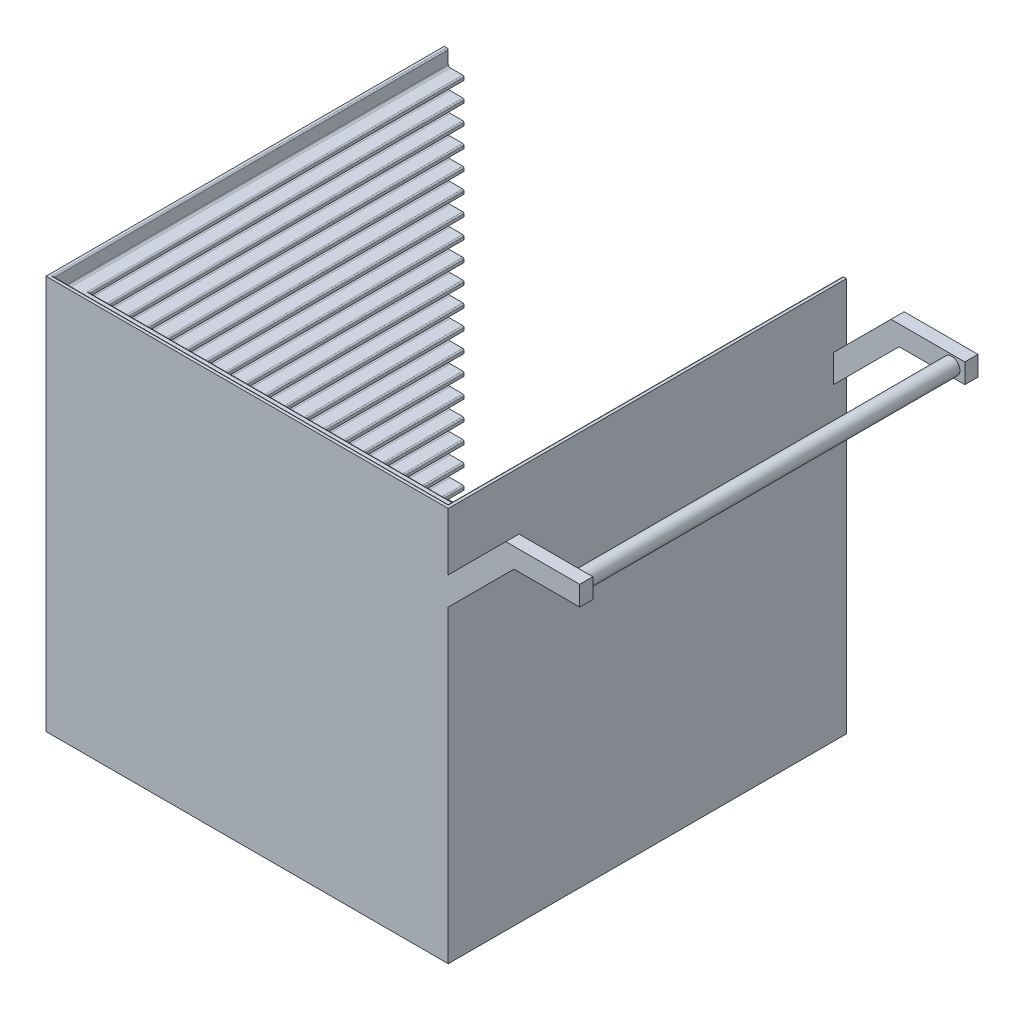
from build123d import *

# Parameters (mm, degrees)
BOSS_EXTRUDE1_DEPTH   = 600
BOSS_EXTRUDE1_2_DEPTH = 600
LPATTERN1_COUNT       = 20
LPATTERN1_PITCH       = 30
SKETCH3_W             = 6
SKETCH3_H             = 30
BOSS_EXTRUDE3_DEPTH   = 612
BOSS_EXTRUDE5_START   = 30
BOSS_EXTRUDE5_DEPTH   = 30
LPATTERN3_COUNT       = 20
LPATTERN3_PITCH       = 30
LPATTERN4_COUNT       = 20
LPATTERN4_PITCH       = 30
FILLET1_R             = 2
SKETCH11_W            = 552
SKETCH11_H            = 570
BOSS_EXTRUDE6_DEPTH   = 6
SKETCH16_W            = 100
SKETCH16_H            = 130
BOSS_EXTRUDE7_DEPTH   = 20
BOSS_EXTRUDE8_DEPTH   = 20
BOSS_EXTRUDE9_DEPTH   = 20
SKETCH19_R            = 12.5
BOSS_EXTRUDE10_DEPTH  = 606


with BuildPart() as part:
    # Sketch1 → Boss-Extrude1 (new body)
    with BuildSketch(Plane.XY):
        with BuildLine():
            Line((-300, 28), (-300, 9))
            ThreePointArc((-300, 9), (-299.121320344, 6.878679656), (-297, 6))
            Line((-297, 6), (-278, 6))
            ThreePointArc((-278, 6), (-276.585786438, 5.414213562), (-276, 4))
            Line((-276, 4), (-276, 0))
            Line((-276, 0), (-306, 0))
            Line((-306, 0), (-306, 30))
            Line((-306, 30), (-302, 30))
            ThreePointArc((-302, 30), (-300.585786438, 29.414213562), (-300, 28))
        make_face()
    boss_extrude1 = extrude(amount=BOSS_EXTRUDE1_DEPTH)


with BuildPart() as body_2:
    # Sketch1 → Boss-Extrude1 2 (new body)
    with BuildSketch(Plane.XY):
        with BuildLine():
            Line((306, 30), (302, 30))
            ThreePointArc((302, 30), (300.585786438, 29.414213562), (300, 28))
            Line((300, 28), (300, 9))
            ThreePointArc((300, 9), (299.121320344, 6.878679656), (297, 6))
            Line((297, 6), (278, 6))
            ThreePointArc((278, 6), (276.585786438, 5.414213562), (276, 4))
            Line((276, 4), (276, 0))
            Line((276, 0), (306, 0))
            Line((306, 0), (306, 30))
        make_face()
    boss_extrude1_2 = extrude(amount=BOSS_EXTRUDE1_2_DEPTH)


with BuildPart() as part_1:
    add(part.part)

    add(body_2.part)  # LPattern1 merges body 2
    # LPattern1: Boss-Extrude1, Boss-Extrude1 2 ×20
    with Locations(*[(0, -i * LPATTERN1_PITCH, 0) for i in range(1, LPATTERN1_COUNT)]):
        add(boss_extrude1)
        add(boss_extrude1_2)

    # Sketch3 → Boss-Extrude3 (add)
    with BuildSketch(Plane.ZY.offset(306)):
        with Locations((603, 15)):
            Rectangle(SKETCH3_W, SKETCH3_H)
    boss_extrude3 = extrude(amount=-BOSS_EXTRUDE3_DEPTH)

    # Sketch5 → Boss-Extrude5 (add)
    with BuildSketch(Plane(origin=(0, 0, 600), x_dir=(-1, 0, 0), z_dir=(0, 0, -1)).offset(BOSS_EXTRUDE5_START)):
        with BuildLine():
            Line((276, 0), (276, 4))
            ThreePointArc((276, 4), (276.585786438, 5.414213562), (278, 6))
            Line((278, 6), (-278, 6))
            ThreePointArc((-278, 6), (-276.585786438, 5.414213562), (-276, 4))
            Line((-276, 4), (-276, 0))
            Line((-276, 0), (276, 0))
        make_face()
    boss_extrude5 = extrude(amount=-BOSS_EXTRUDE5_DEPTH)

    # LPattern3: Boss-Extrude3 ×20
    with Locations(*[(0, -i * LPATTERN3_PITCH, 0) for i in range(1, LPATTERN3_COUNT)]):
        add(boss_extrude3)

    # LPattern4: Boss-Extrude5 ×20
    with Locations(*[(0, -i * LPATTERN4_PITCH, 0) for i in range(1, LPATTERN4_COUNT)]):
        add(boss_extrude5)

    # Fillet1
    fillet1_edges = [part_1.edges().sort_by_distance(p)[0] for p in [
        (0, 6, 570),
        (0, -414, 570),
        (0, -444, 570),
        (0, -474, 570),
        (0, -504, 570),
        (0, -534, 570),
        (0, -564, 570),
        (0, -384, 570),
        (0, -360, 600),
        (0, -324, 570),
        (0, -294, 570),
        (0, -264, 570),
        (0, -234, 570),
        (0, -204, 570),
        (0, -174, 570),
        (0, -144, 570),
        (0, -114, 570),
        (0, -84, 570),
        (0, -54, 570),
        (0, -24, 570),
        (0, 30, 600),
    ]]
    fillet(fillet1_edges, radius=FILLET1_R)



with BuildPart() as body_2_2:
    # Sketch11 → Boss-Extrude6 (new body)
    with BuildSketch(Plane.XZ.offset(570)):
        with Locations((0, 285)):
            Rectangle(SKETCH11_W, SKETCH11_H)
    extrude(amount=-BOSS_EXTRUDE6_DEPTH)


with BuildPart() as part_2:
    add(part_1.part)

    add(body_2_2.part)  # Boss-Extrude7 merges body 2 2
    # Sketch16 → Boss-Extrude7 (add)
    with BuildSketch(Plane.XZ.offset(570)):
        with Locations((-206, 115)):
            Rectangle(SKETCH16_W, SKETCH16_H)
        with Locations((206, 115)):
            Rectangle(SKETCH16_W, SKETCH16_H)
        with Locations((206, 491)):
            Rectangle(SKETCH16_W, SKETCH16_H)
        with Locations((-206, 491)):
            Rectangle(SKETCH16_W, SKETCH16_H)
    extrude(amount=BOSS_EXTRUDE7_DEPTH)

    # Sketch18 → Boss-Extrude9 (add)
    with BuildSketch(Plane.XY.offset(606)):
        Polygon((306, -57.573593129), (306, -100), (406, 0), (506, 0), (506, 30), (393.573593129, 30), align=None)
    extrude(amount=-BOSS_EXTRUDE9_DEPTH)



with BuildPart() as body_2_3:
    # Sketch17 → Boss-Extrude8 (new body)
    with BuildSketch(Plane(origin=(0, 0, 0), x_dir=(-1, 0, 0), z_dir=(0, 0, -1))):
        Polygon((-306, -100), (-406, 0), (-506, 0), (-506, 30), (-393.573593129, 30), (-306, -57.573593129), align=None)
    extrude(amount=-BOSS_EXTRUDE8_DEPTH)


with BuildPart() as part_3:
    add(part_2.part)

    add(body_2_3.part)  # Boss-Extrude10 merges body 2 3
    # Sketch19 → Boss-Extrude10 (add)
    with BuildSketch(Plane(origin=(0, 0, 0), x_dir=(-1, 0, 0), z_dir=(0, 0, -1))):
        with Locations((-486, 15)):
            Circle(SKETCH19_R)
    extrude(amount=-BOSS_EXTRUDE10_DEPTH)


solid = part_3.part
